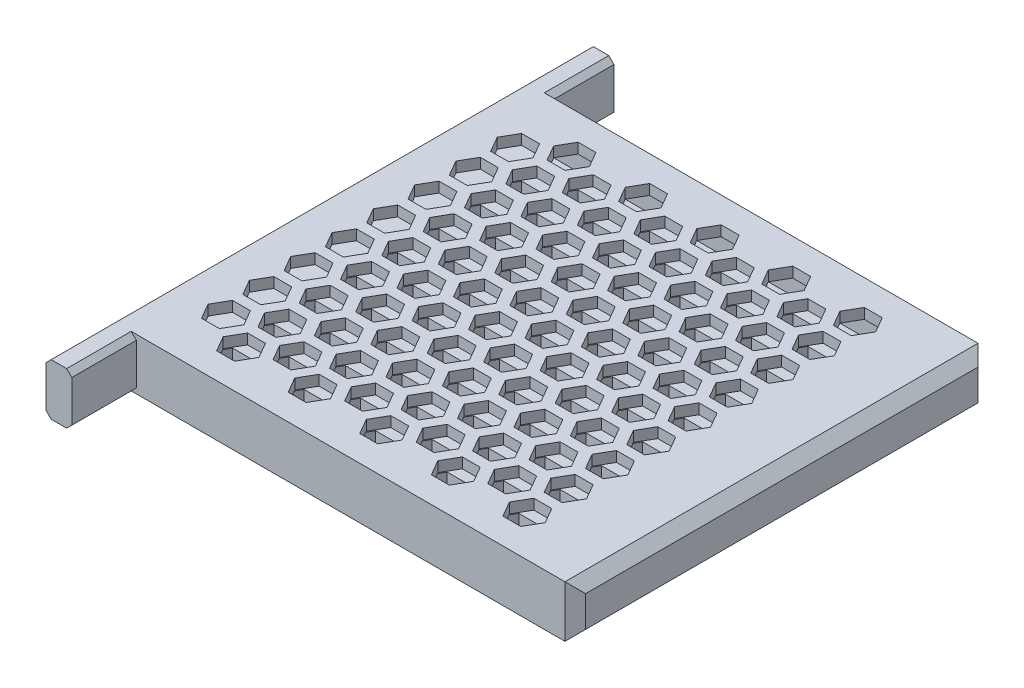
from build123d import *

# Parameters (mm, degrees)
ESQUISSE1_W                            = 90
ESQUISSE1_H                            = 80
BOSS_EXTRU_1_DEPTH                     = 10
CHANFREIN1_SIZE                        = 2
COQUE1_T                               = -2
ESQUISSE2_W                            = 5
ESQUISSE2_H                            = 12.5
BOSS_EXTRU_2_DEPTH                     = 10
CHANFREIN2_SIZE                        = 1
ENL_V_MAT_EXTRU_1_DEPTH                = 10
R_P_TITION_LIN_AIRE2_COUNT             = 2
R_P_TITION_LIN_AIRE2_PITCH             = 8
R_P_TITION_LIN_AIRE3_COUNT             = 4
R_P_TITION_LIN_AIRE3_PITCH             = 8
R_P_TITION_LIN_AIRE3_COPY_1_DEPTH      = 10
R_P_TITION_LIN_AIRE3_COPY_2_DEPTH      = 10
R_P_TITION_LIN_AIRE3_COPY_3_DEPTH      = 10
R_P_TITION_LIN_AIRE3_COL_COUNT         = 5
R_P_TITION_LIN_AIRE3_COL_PITCH         = 8
R_P_TITION_LIN_AIRE3_COL_COPY_1_DEPTH  = 10
R_P_TITION_LIN_AIRE3_COL_COPY_2_DEPTH  = 10
R_P_TITION_LIN_AIRE3_COL_COPY_3_DEPTH  = 10
R_P_TITION_LIN_AIRE3_COL_COPY_4_DEPTH  = 10
R_P_TITION_LIN_AIRE4_COUNT             = 2
R_P_TITION_LIN_AIRE4_PITCH             = 32
R_P_TITION_LIN_AIRE5_COUNT             = 3
R_P_TITION_LIN_AIRE5_PITCH             = 13.86
R_P_TITION_LIN_AIRE5_COPY_1_DEPTH      = 10
R_P_TITION_LIN_AIRE5_COPY_2_DEPTH      = 10
R_P_TITION_LIN_AIRE5_COPY_3_DEPTH      = 10
R_P_TITION_LIN_AIRE5_COPY_4_DEPTH      = 10
R_P_TITION_LIN_AIRE5_COPY_5_DEPTH      = 10
R_P_TITION_LIN_AIRE5_COPY_6_DEPTH      = 10
R_P_TITION_LIN_AIRE5_COPY_7_DEPTH      = 10
R_P_TITION_LIN_AIRE5_COPY_8_DEPTH      = 10
R_P_TITION_LIN_AIRE5_COPY_9_DEPTH      = 10
R_P_TITION_LIN_AIRE5_COPY_10_DEPTH     = 10
R_P_TITION_LIN_AIRE5_COPY_11_DEPTH     = 10
R_P_TITION_LIN_AIRE5_COPY_12_DEPTH     = 10
R_P_TITION_LIN_AIRE5_COPY_13_DEPTH     = 10
R_P_TITION_LIN_AIRE5_COPY_14_DEPTH     = 10
R_P_TITION_LIN_AIRE5_COPY_15_DEPTH     = 10
R_P_TITION_LIN_AIRE5_COPY_16_DEPTH     = 10
R_P_TITION_LIN_AIRE5_COPY_17_DEPTH     = 10
R_P_TITION_LIN_AIRE5_COPY_18_DEPTH     = 10
R_P_TITION_LIN_AIRE5_COPY_19_DEPTH     = 10
R_P_TITION_LIN_AIRE5_COPY_20_DEPTH     = 10
R_P_TITION_LIN_AIRE5_COPY_21_DEPTH     = 10
R_P_TITION_LIN_AIRE5_COPY_22_DEPTH     = 10
R_P_TITION_LIN_AIRE5_COPY_23_DEPTH     = 10
R_P_TITION_LIN_AIRE5_COPY_24_DEPTH     = 10
R_P_TITION_LIN_AIRE5_COPY_25_DEPTH     = 10
R_P_TITION_LIN_AIRE5_COPY_26_DEPTH     = 10
R_P_TITION_LIN_AIRE5_COPY_27_DEPTH     = 10
R_P_TITION_LIN_AIRE5_COPY_28_DEPTH     = 10
R_P_TITION_LIN_AIRE5_COPY_29_DEPTH     = 10
R_P_TITION_LIN_AIRE5_COPY_30_DEPTH     = 10
R_P_TITION_LIN_AIRE5_COPY_31_DEPTH     = 10
R_P_TITION_LIN_AIRE5_COPY_32_DEPTH     = 10
R_P_TITION_LIN_AIRE5_COL_COUNT         = 3
R_P_TITION_LIN_AIRE5_COL_PITCH         = 13.86
R_P_TITION_LIN_AIRE5_COL_COPY_1_DEPTH  = 10
R_P_TITION_LIN_AIRE5_COL_COPY_2_DEPTH  = 10
R_P_TITION_LIN_AIRE5_COL_COPY_3_DEPTH  = 10
R_P_TITION_LIN_AIRE5_COL_COPY_4_DEPTH  = 10
R_P_TITION_LIN_AIRE5_COL_COPY_5_DEPTH  = 10
R_P_TITION_LIN_AIRE5_COL_COPY_6_DEPTH  = 10
R_P_TITION_LIN_AIRE5_COL_COPY_7_DEPTH  = 10
R_P_TITION_LIN_AIRE5_COL_COPY_8_DEPTH  = 10
R_P_TITION_LIN_AIRE5_COL_COPY_9_DEPTH  = 10
R_P_TITION_LIN_AIRE5_COL_COPY_10_DEPTH = 10
R_P_TITION_LIN_AIRE5_COL_COPY_11_DEPTH = 10
R_P_TITION_LIN_AIRE5_COL_COPY_12_DEPTH = 10
R_P_TITION_LIN_AIRE5_COL_COPY_13_DEPTH = 10
R_P_TITION_LIN_AIRE5_COL_COPY_14_DEPTH = 10
R_P_TITION_LIN_AIRE5_COL_COPY_15_DEPTH = 10
R_P_TITION_LIN_AIRE5_COL_COPY_16_DEPTH = 10
R_P_TITION_LIN_AIRE5_COL_COPY_17_DEPTH = 10
R_P_TITION_LIN_AIRE5_COL_COPY_18_DEPTH = 10
R_P_TITION_LIN_AIRE5_COL_COPY_19_DEPTH = 10
R_P_TITION_LIN_AIRE5_COL_COPY_20_DEPTH = 10
R_P_TITION_LIN_AIRE5_COL_COPY_21_DEPTH = 10
R_P_TITION_LIN_AIRE5_COL_COPY_22_DEPTH = 10
R_P_TITION_LIN_AIRE5_COL_COPY_23_DEPTH = 10
R_P_TITION_LIN_AIRE5_COL_COPY_24_DEPTH = 10
R_P_TITION_LIN_AIRE5_COL_COPY_25_DEPTH = 10
R_P_TITION_LIN_AIRE5_COL_COPY_26_DEPTH = 10
R_P_TITION_LIN_AIRE5_COL_COPY_27_DEPTH = 10
R_P_TITION_LIN_AIRE5_COL_COPY_28_DEPTH = 10
R_P_TITION_LIN_AIRE5_COL_COPY_29_DEPTH = 10
R_P_TITION_LIN_AIRE5_COL_COPY_30_DEPTH = 10
R_P_TITION_LIN_AIRE5_COL_COPY_31_DEPTH = 10
R_P_TITION_LIN_AIRE5_COL_COPY_32_DEPTH = 10


with BuildPart() as part:
    # Esquisse1 → Boss.-Extru.1 (new body)
    with BuildSketch(Plane(origin=(0, 0, 0), x_dir=(1, 0, 0), z_dir=(0, 1, 0))):
        Rectangle(ESQUISSE1_W, ESQUISSE1_H)
    extrude(amount=BOSS_EXTRU_1_DEPTH)

    # Chanfrein1
    chanfrein1_edges = [part.edges().sort_by_distance(p)[0] for p in [
        (45, 0, 0),
        (45, 5, -40),
        (45, 5, 40),
        (45, 10, 0),
    ]]
    chamfer(chanfrein1_edges, length=CHANFREIN1_SIZE)

    # Coque1
    coque1_openings = [part.faces().sort_by_distance(p)[0] for p in [
        (-45, 5, 0),
    ]]
    offset(amount=COQUE1_T, openings=coque1_openings, kind=Kind.INTERSECTION)

    # Esquisse2 → Boss.-Extru.2 (add)
    with BuildSketch(Plane(origin=(0, 10, 0), x_dir=(1, 0, 0), z_dir=(0, 1, 0))):
        with Locations((-42.5, 46.25)):
            Rectangle(ESQUISSE2_W, ESQUISSE2_H)
        with Locations((-42.5, -46.25)):
            Rectangle(ESQUISSE2_W, ESQUISSE2_H)
    extrude(amount=-BOSS_EXTRU_2_DEPTH)

    # Chanfrein2
    chanfrein2_edges = [part.edges().sort_by_distance(p)[0] for p in [
        (-45, 10, 0),
        (-40, 0, 46.25),
        (-45, 0, 0),
        (-40, 10, 46.25),
        (-40, 0, -46.25),
        (-40, 10, -46.25),
    ]]
    chamfer(chanfrein2_edges, length=CHANFREIN2_SIZE)

    # Esquisse3 → Enlèv. mat.-Extru.1 (cut)
    with BuildSketch(Plane.XZ):
        Polygon((3.464101615, 0), (1.732050808, 3), (-1.732050808, 3), (-3.464101615, 0), (-1.732050808, -3), (1.732050808, -3), align=None)
    enl_v_mat_extru_1 = extrude(amount=-ENL_V_MAT_EXTRU_1_DEPTH, mode=Mode.SUBTRACT)

    # Répétition linéaire2: Enlèv. mat.-Extru.1 ×2
    with Locations(*[Vector(-0.8660254037844387, 0, 0.5000000000000001) * (i * R_P_TITION_LIN_AIRE2_PITCH) for i in range(1, R_P_TITION_LIN_AIRE2_COUNT)]):
        add(enl_v_mat_extru_1, mode=Mode.SUBTRACT)

    # Répétition linéaire3: Enlèv. mat.-Extru.1 ×4
    with Locations(*[(0, 0, i * R_P_TITION_LIN_AIRE3_PITCH) for i in range(1, R_P_TITION_LIN_AIRE3_COUNT)]):
        add(enl_v_mat_extru_1, mode=Mode.SUBTRACT)

    # Répétition linéaire3 copy 1 sketch → Répétition linéaire3 copy 1 (cut)
    with BuildSketch(Plane(origin=(-6.92820323, 0, 12), x_dir=(1, 0, 0), z_dir=(0, -1, 0))):
        Polygon((3.464101615, 0), (1.732050808, 3), (-1.732050808, 3), (-3.464101615, 0), (-1.732050808, -3), (1.732050808, -3), align=None)
    extrude(amount=-R_P_TITION_LIN_AIRE3_COPY_1_DEPTH, mode=Mode.SUBTRACT)

    # Répétition linéaire3 copy 2 sketch → Répétition linéaire3 copy 2 (cut)
    with BuildSketch(Plane(origin=(-6.92820323, 0, 20), x_dir=(1, 0, 0), z_dir=(0, -1, 0))):
        Polygon((3.464101615, 0), (1.732050808, 3), (-1.732050808, 3), (-3.464101615, 0), (-1.732050808, -3), (1.732050808, -3), align=None)
    extrude(amount=-R_P_TITION_LIN_AIRE3_COPY_2_DEPTH, mode=Mode.SUBTRACT)

    # Répétition linéaire3 copy 3 sketch → Répétition linéaire3 copy 3 (cut)
    with BuildSketch(Plane(origin=(-6.92820323, 0, 28), x_dir=(1, 0, 0), z_dir=(0, -1, 0))):
        Polygon((3.464101615, 0), (1.732050808, 3), (-1.732050808, 3), (-3.464101615, 0), (-1.732050808, -3), (1.732050808, -3), align=None)
    extrude(amount=-R_P_TITION_LIN_AIRE3_COPY_3_DEPTH, mode=Mode.SUBTRACT)

    # Répétition linéaire3 col: Enlèv. mat.-Extru.1 ×5
    with Locations(*[(0, 0, -i * R_P_TITION_LIN_AIRE3_COL_PITCH) for i in range(1, R_P_TITION_LIN_AIRE3_COL_COUNT)]):
        add(enl_v_mat_extru_1, mode=Mode.SUBTRACT)

    # Répétition linéaire3 col copy 1 sketch → Répétition linéaire3 col copy 1 (cut)
    with BuildSketch(Plane(origin=(-6.92820323, 0, -4), x_dir=(1, 0, 0), z_dir=(0, -1, 0))):
        Polygon((3.464101615, 0), (1.732050808, 3), (-1.732050808, 3), (-3.464101615, 0), (-1.732050808, -3), (1.732050808, -3), align=None)
    extrude(amount=-R_P_TITION_LIN_AIRE3_COL_COPY_1_DEPTH, mode=Mode.SUBTRACT)

    # Répétition linéaire3 col copy 2 sketch → Répétition linéaire3 col copy 2 (cut)
    with BuildSketch(Plane(origin=(-6.92820323, 0, -12), x_dir=(1, 0, 0), z_dir=(0, -1, 0))):
        Polygon((3.464101615, 0), (1.732050808, 3), (-1.732050808, 3), (-3.464101615, 0), (-1.732050808, -3), (1.732050808, -3), align=None)
    extrude(amount=-R_P_TITION_LIN_AIRE3_COL_COPY_2_DEPTH, mode=Mode.SUBTRACT)

    # Répétition linéaire3 col copy 3 sketch → Répétition linéaire3 col copy 3 (cut)
    with BuildSketch(Plane(origin=(-6.92820323, 0, -20), x_dir=(1, 0, 0), z_dir=(0, -1, 0))):
        Polygon((3.464101615, 0), (1.732050808, 3), (-1.732050808, 3), (-3.464101615, 0), (-1.732050808, -3), (1.732050808, -3), align=None)
    extrude(amount=-R_P_TITION_LIN_AIRE3_COL_COPY_3_DEPTH, mode=Mode.SUBTRACT)

    # Répétition linéaire3 col copy 4 sketch → Répétition linéaire3 col copy 4 (cut)
    with BuildSketch(Plane(origin=(-6.92820323, 0, -28), x_dir=(1, 0, 0), z_dir=(0, -1, 0))):
        Polygon((3.464101615, 0), (1.732050808, 3), (-1.732050808, 3), (-3.464101615, 0), (-1.732050808, -3), (1.732050808, -3), align=None)
    extrude(amount=-R_P_TITION_LIN_AIRE3_COL_COPY_4_DEPTH, mode=Mode.SUBTRACT)

    # Répétition linéaire4: Enlèv. mat.-Extru.1 ×2
    with Locations(*[(0, 0, i * R_P_TITION_LIN_AIRE4_PITCH) for i in range(1, R_P_TITION_LIN_AIRE4_COUNT)]):
        add(enl_v_mat_extru_1, mode=Mode.SUBTRACT)

    # Répétition linéaire5: Enlèv. mat.-Extru.1 ×3
    with Locations(*[(i * R_P_TITION_LIN_AIRE5_PITCH, 0, 0) for i in range(1, R_P_TITION_LIN_AIRE5_COUNT)]):
        add(enl_v_mat_extru_1, mode=Mode.SUBTRACT)

    # Répétition linéaire5 copy 1 sketch → Répétition linéaire5 copy 1 (cut)
    with BuildSketch(Plane(origin=(6.93179677, 0, 4), x_dir=(1, 0, 0), z_dir=(0, -1, 0))):
        Polygon((3.464101615, 0), (1.732050808, 3), (-1.732050808, 3), (-3.464101615, 0), (-1.732050808, -3), (1.732050808, -3), align=None)
    extrude(amount=-R_P_TITION_LIN_AIRE5_COPY_1_DEPTH, mode=Mode.SUBTRACT)

    # Répétition linéaire5 copy 2 sketch → Répétition linéaire5 copy 2 (cut)
    with BuildSketch(Plane(origin=(20.79179677, 0, 4), x_dir=(1, 0, 0), z_dir=(0, -1, 0))):
        Polygon((3.464101615, 0), (1.732050808, 3), (-1.732050808, 3), (-3.464101615, 0), (-1.732050808, -3), (1.732050808, -3), align=None)
    extrude(amount=-R_P_TITION_LIN_AIRE5_COPY_2_DEPTH, mode=Mode.SUBTRACT)

    # Répétition linéaire5 copy 3 sketch → Répétition linéaire5 copy 3 (cut)
    with BuildSketch(Plane(origin=(13.86, 0, 8), x_dir=(1, 0, 0), z_dir=(0, -1, 0))):
        Polygon((3.464101615, 0), (1.732050808, 3), (-1.732050808, 3), (-3.464101615, 0), (-1.732050808, -3), (1.732050808, -3), align=None)
    extrude(amount=-R_P_TITION_LIN_AIRE5_COPY_3_DEPTH, mode=Mode.SUBTRACT)

    # Répétition linéaire5 copy 4 sketch → Répétition linéaire5 copy 4 (cut)
    with BuildSketch(Plane(origin=(27.72, 0, 8), x_dir=(1, 0, 0), z_dir=(0, -1, 0))):
        Polygon((3.464101615, 0), (1.732050808, 3), (-1.732050808, 3), (-3.464101615, 0), (-1.732050808, -3), (1.732050808, -3), align=None)
    extrude(amount=-R_P_TITION_LIN_AIRE5_COPY_4_DEPTH, mode=Mode.SUBTRACT)

    # Répétition linéaire5 copy 5 sketch → Répétition linéaire5 copy 5 (cut)
    with BuildSketch(Plane(origin=(13.86, 0, 16), x_dir=(1, 0, 0), z_dir=(0, -1, 0))):
        Polygon((3.464101615, 0), (1.732050808, 3), (-1.732050808, 3), (-3.464101615, 0), (-1.732050808, -3), (1.732050808, -3), align=None)
    extrude(amount=-R_P_TITION_LIN_AIRE5_COPY_5_DEPTH, mode=Mode.SUBTRACT)

    # Répétition linéaire5 copy 6 sketch → Répétition linéaire5 copy 6 (cut)
    with BuildSketch(Plane(origin=(27.72, 0, 16), x_dir=(1, 0, 0), z_dir=(0, -1, 0))):
        Polygon((3.464101615, 0), (1.732050808, 3), (-1.732050808, 3), (-3.464101615, 0), (-1.732050808, -3), (1.732050808, -3), align=None)
    extrude(amount=-R_P_TITION_LIN_AIRE5_COPY_6_DEPTH, mode=Mode.SUBTRACT)

    # Répétition linéaire5 copy 7 sketch → Répétition linéaire5 copy 7 (cut)
    with BuildSketch(Plane(origin=(13.86, 0, 24), x_dir=(1, 0, 0), z_dir=(0, -1, 0))):
        Polygon((3.464101615, 0), (1.732050808, 3), (-1.732050808, 3), (-3.464101615, 0), (-1.732050808, -3), (1.732050808, -3), align=None)
    extrude(amount=-R_P_TITION_LIN_AIRE5_COPY_7_DEPTH, mode=Mode.SUBTRACT)

    # Répétition linéaire5 copy 8 sketch → Répétition linéaire5 copy 8 (cut)
    with BuildSketch(Plane(origin=(27.72, 0, 24), x_dir=(1, 0, 0), z_dir=(0, -1, 0))):
        Polygon((3.464101615, 0), (1.732050808, 3), (-1.732050808, 3), (-3.464101615, 0), (-1.732050808, -3), (1.732050808, -3), align=None)
    extrude(amount=-R_P_TITION_LIN_AIRE5_COPY_8_DEPTH, mode=Mode.SUBTRACT)

    # Répétition linéaire5 copy 9 sketch → Répétition linéaire5 copy 9 (cut)
    with BuildSketch(Plane(origin=(6.93179677, 0, 12), x_dir=(1, 0, 0), z_dir=(0, -1, 0))):
        Polygon((3.464101615, 0), (1.732050808, 3), (-1.732050808, 3), (-3.464101615, 0), (-1.732050808, -3), (1.732050808, -3), align=None)
    extrude(amount=-R_P_TITION_LIN_AIRE5_COPY_9_DEPTH, mode=Mode.SUBTRACT)

    # Répétition linéaire5 copy 10 sketch → Répétition linéaire5 copy 10 (cut)
    with BuildSketch(Plane(origin=(20.79179677, 0, 12), x_dir=(1, 0, 0), z_dir=(0, -1, 0))):
        Polygon((3.464101615, 0), (1.732050808, 3), (-1.732050808, 3), (-3.464101615, 0), (-1.732050808, -3), (1.732050808, -3), align=None)
    extrude(amount=-R_P_TITION_LIN_AIRE5_COPY_10_DEPTH, mode=Mode.SUBTRACT)

    # Répétition linéaire5 copy 11 sketch → Répétition linéaire5 copy 11 (cut)
    with BuildSketch(Plane(origin=(6.93179677, 0, 20), x_dir=(1, 0, 0), z_dir=(0, -1, 0))):
        Polygon((3.464101615, 0), (1.732050808, 3), (-1.732050808, 3), (-3.464101615, 0), (-1.732050808, -3), (1.732050808, -3), align=None)
    extrude(amount=-R_P_TITION_LIN_AIRE5_COPY_11_DEPTH, mode=Mode.SUBTRACT)

    # Répétition linéaire5 copy 12 sketch → Répétition linéaire5 copy 12 (cut)
    with BuildSketch(Plane(origin=(20.79179677, 0, 20), x_dir=(1, 0, 0), z_dir=(0, -1, 0))):
        Polygon((3.464101615, 0), (1.732050808, 3), (-1.732050808, 3), (-3.464101615, 0), (-1.732050808, -3), (1.732050808, -3), align=None)
    extrude(amount=-R_P_TITION_LIN_AIRE5_COPY_12_DEPTH, mode=Mode.SUBTRACT)

    # Répétition linéaire5 copy 13 sketch → Répétition linéaire5 copy 13 (cut)
    with BuildSketch(Plane(origin=(6.93179677, 0, 28), x_dir=(1, 0, 0), z_dir=(0, -1, 0))):
        Polygon((3.464101615, 0), (1.732050808, 3), (-1.732050808, 3), (-3.464101615, 0), (-1.732050808, -3), (1.732050808, -3), align=None)
    extrude(amount=-R_P_TITION_LIN_AIRE5_COPY_13_DEPTH, mode=Mode.SUBTRACT)

    # Répétition linéaire5 copy 14 sketch → Répétition linéaire5 copy 14 (cut)
    with BuildSketch(Plane(origin=(20.79179677, 0, 28), x_dir=(1, 0, 0), z_dir=(0, -1, 0))):
        Polygon((3.464101615, 0), (1.732050808, 3), (-1.732050808, 3), (-3.464101615, 0), (-1.732050808, -3), (1.732050808, -3), align=None)
    extrude(amount=-R_P_TITION_LIN_AIRE5_COPY_14_DEPTH, mode=Mode.SUBTRACT)

    # Répétition linéaire5 copy 15 sketch → Répétition linéaire5 copy 15 (cut)
    with BuildSketch(Plane(origin=(13.86, 0, -8), x_dir=(1, 0, 0), z_dir=(0, -1, 0))):
        Polygon((3.464101615, 0), (1.732050808, 3), (-1.732050808, 3), (-3.464101615, 0), (-1.732050808, -3), (1.732050808, -3), align=None)
    extrude(amount=-R_P_TITION_LIN_AIRE5_COPY_15_DEPTH, mode=Mode.SUBTRACT)

    # Répétition linéaire5 copy 16 sketch → Répétition linéaire5 copy 16 (cut)
    with BuildSketch(Plane(origin=(27.72, 0, -8), x_dir=(1, 0, 0), z_dir=(0, -1, 0))):
        Polygon((3.464101615, 0), (1.732050808, 3), (-1.732050808, 3), (-3.464101615, 0), (-1.732050808, -3), (1.732050808, -3), align=None)
    extrude(amount=-R_P_TITION_LIN_AIRE5_COPY_16_DEPTH, mode=Mode.SUBTRACT)

    # Répétition linéaire5 copy 17 sketch → Répétition linéaire5 copy 17 (cut)
    with BuildSketch(Plane(origin=(13.86, 0, -16), x_dir=(1, 0, 0), z_dir=(0, -1, 0))):
        Polygon((3.464101615, 0), (1.732050808, 3), (-1.732050808, 3), (-3.464101615, 0), (-1.732050808, -3), (1.732050808, -3), align=None)
    extrude(amount=-R_P_TITION_LIN_AIRE5_COPY_17_DEPTH, mode=Mode.SUBTRACT)

    # Répétition linéaire5 copy 18 sketch → Répétition linéaire5 copy 18 (cut)
    with BuildSketch(Plane(origin=(27.72, 0, -16), x_dir=(1, 0, 0), z_dir=(0, -1, 0))):
        Polygon((3.464101615, 0), (1.732050808, 3), (-1.732050808, 3), (-3.464101615, 0), (-1.732050808, -3), (1.732050808, -3), align=None)
    extrude(amount=-R_P_TITION_LIN_AIRE5_COPY_18_DEPTH, mode=Mode.SUBTRACT)

    # Répétition linéaire5 copy 19 sketch → Répétition linéaire5 copy 19 (cut)
    with BuildSketch(Plane(origin=(13.86, 0, -24), x_dir=(1, 0, 0), z_dir=(0, -1, 0))):
        Polygon((3.464101615, 0), (1.732050808, 3), (-1.732050808, 3), (-3.464101615, 0), (-1.732050808, -3), (1.732050808, -3), align=None)
    extrude(amount=-R_P_TITION_LIN_AIRE5_COPY_19_DEPTH, mode=Mode.SUBTRACT)

    # Répétition linéaire5 copy 20 sketch → Répétition linéaire5 copy 20 (cut)
    with BuildSketch(Plane(origin=(27.72, 0, -24), x_dir=(1, 0, 0), z_dir=(0, -1, 0))):
        Polygon((3.464101615, 0), (1.732050808, 3), (-1.732050808, 3), (-3.464101615, 0), (-1.732050808, -3), (1.732050808, -3), align=None)
    extrude(amount=-R_P_TITION_LIN_AIRE5_COPY_20_DEPTH, mode=Mode.SUBTRACT)

    # Répétition linéaire5 copy 21 sketch → Répétition linéaire5 copy 21 (cut)
    with BuildSketch(Plane(origin=(13.86, 0, -32), x_dir=(1, 0, 0), z_dir=(0, -1, 0))):
        Polygon((3.464101615, 0), (1.732050808, 3), (-1.732050808, 3), (-3.464101615, 0), (-1.732050808, -3), (1.732050808, -3), align=None)
    extrude(amount=-R_P_TITION_LIN_AIRE5_COPY_21_DEPTH, mode=Mode.SUBTRACT)

    # Répétition linéaire5 copy 22 sketch → Répétition linéaire5 copy 22 (cut)
    with BuildSketch(Plane(origin=(27.72, 0, -32), x_dir=(1, 0, 0), z_dir=(0, -1, 0))):
        Polygon((3.464101615, 0), (1.732050808, 3), (-1.732050808, 3), (-3.464101615, 0), (-1.732050808, -3), (1.732050808, -3), align=None)
    extrude(amount=-R_P_TITION_LIN_AIRE5_COPY_22_DEPTH, mode=Mode.SUBTRACT)

    # Répétition linéaire5 copy 23 sketch → Répétition linéaire5 copy 23 (cut)
    with BuildSketch(Plane(origin=(6.93179677, 0, -4), x_dir=(1, 0, 0), z_dir=(0, -1, 0))):
        Polygon((3.464101615, 0), (1.732050808, 3), (-1.732050808, 3), (-3.464101615, 0), (-1.732050808, -3), (1.732050808, -3), align=None)
    extrude(amount=-R_P_TITION_LIN_AIRE5_COPY_23_DEPTH, mode=Mode.SUBTRACT)

    # Répétition linéaire5 copy 24 sketch → Répétition linéaire5 copy 24 (cut)
    with BuildSketch(Plane(origin=(20.79179677, 0, -4), x_dir=(1, 0, 0), z_dir=(0, -1, 0))):
        Polygon((3.464101615, 0), (1.732050808, 3), (-1.732050808, 3), (-3.464101615, 0), (-1.732050808, -3), (1.732050808, -3), align=None)
    extrude(amount=-R_P_TITION_LIN_AIRE5_COPY_24_DEPTH, mode=Mode.SUBTRACT)

    # Répétition linéaire5 copy 25 sketch → Répétition linéaire5 copy 25 (cut)
    with BuildSketch(Plane(origin=(6.93179677, 0, -12), x_dir=(1, 0, 0), z_dir=(0, -1, 0))):
        Polygon((3.464101615, 0), (1.732050808, 3), (-1.732050808, 3), (-3.464101615, 0), (-1.732050808, -3), (1.732050808, -3), align=None)
    extrude(amount=-R_P_TITION_LIN_AIRE5_COPY_25_DEPTH, mode=Mode.SUBTRACT)

    # Répétition linéaire5 copy 26 sketch → Répétition linéaire5 copy 26 (cut)
    with BuildSketch(Plane(origin=(20.79179677, 0, -12), x_dir=(1, 0, 0), z_dir=(0, -1, 0))):
        Polygon((3.464101615, 0), (1.732050808, 3), (-1.732050808, 3), (-3.464101615, 0), (-1.732050808, -3), (1.732050808, -3), align=None)
    extrude(amount=-R_P_TITION_LIN_AIRE5_COPY_26_DEPTH, mode=Mode.SUBTRACT)

    # Répétition linéaire5 copy 27 sketch → Répétition linéaire5 copy 27 (cut)
    with BuildSketch(Plane(origin=(6.93179677, 0, -20), x_dir=(1, 0, 0), z_dir=(0, -1, 0))):
        Polygon((3.464101615, 0), (1.732050808, 3), (-1.732050808, 3), (-3.464101615, 0), (-1.732050808, -3), (1.732050808, -3), align=None)
    extrude(amount=-R_P_TITION_LIN_AIRE5_COPY_27_DEPTH, mode=Mode.SUBTRACT)

    # Répétition linéaire5 copy 28 sketch → Répétition linéaire5 copy 28 (cut)
    with BuildSketch(Plane(origin=(20.79179677, 0, -20), x_dir=(1, 0, 0), z_dir=(0, -1, 0))):
        Polygon((3.464101615, 0), (1.732050808, 3), (-1.732050808, 3), (-3.464101615, 0), (-1.732050808, -3), (1.732050808, -3), align=None)
    extrude(amount=-R_P_TITION_LIN_AIRE5_COPY_28_DEPTH, mode=Mode.SUBTRACT)

    # Répétition linéaire5 copy 29 sketch → Répétition linéaire5 copy 29 (cut)
    with BuildSketch(Plane(origin=(6.93179677, 0, -28), x_dir=(1, 0, 0), z_dir=(0, -1, 0))):
        Polygon((3.464101615, 0), (1.732050808, 3), (-1.732050808, 3), (-3.464101615, 0), (-1.732050808, -3), (1.732050808, -3), align=None)
    extrude(amount=-R_P_TITION_LIN_AIRE5_COPY_29_DEPTH, mode=Mode.SUBTRACT)

    # Répétition linéaire5 copy 30 sketch → Répétition linéaire5 copy 30 (cut)
    with BuildSketch(Plane(origin=(20.79179677, 0, -28), x_dir=(1, 0, 0), z_dir=(0, -1, 0))):
        Polygon((3.464101615, 0), (1.732050808, 3), (-1.732050808, 3), (-3.464101615, 0), (-1.732050808, -3), (1.732050808, -3), align=None)
    extrude(amount=-R_P_TITION_LIN_AIRE5_COPY_30_DEPTH, mode=Mode.SUBTRACT)

    # Répétition linéaire5 copy 31 sketch → Répétition linéaire5 copy 31 (cut)
    with BuildSketch(Plane(origin=(13.86, 0, 32), x_dir=(1, 0, 0), z_dir=(0, -1, 0))):
        Polygon((3.464101615, 0), (1.732050808, 3), (-1.732050808, 3), (-3.464101615, 0), (-1.732050808, -3), (1.732050808, -3), align=None)
    extrude(amount=-R_P_TITION_LIN_AIRE5_COPY_31_DEPTH, mode=Mode.SUBTRACT)

    # Répétition linéaire5 copy 32 sketch → Répétition linéaire5 copy 32 (cut)
    with BuildSketch(Plane(origin=(27.72, 0, 32), x_dir=(1, 0, 0), z_dir=(0, -1, 0))):
        Polygon((3.464101615, 0), (1.732050808, 3), (-1.732050808, 3), (-3.464101615, 0), (-1.732050808, -3), (1.732050808, -3), align=None)
    extrude(amount=-R_P_TITION_LIN_AIRE5_COPY_32_DEPTH, mode=Mode.SUBTRACT)

    # Répétition linéaire5 col: Enlèv. mat.-Extru.1 ×3
    with Locations(*[(-i * R_P_TITION_LIN_AIRE5_COL_PITCH, 0, 0) for i in range(1, R_P_TITION_LIN_AIRE5_COL_COUNT)]):
        add(enl_v_mat_extru_1, mode=Mode.SUBTRACT)

    # Répétition linéaire5 col copy 1 sketch → Répétition linéaire5 col copy 1 (cut)
    with BuildSketch(Plane(origin=(-20.78820323, 0, 4), x_dir=(1, 0, 0), z_dir=(0, -1, 0))):
        Polygon((3.464101615, 0), (1.732050808, 3), (-1.732050808, 3), (-3.464101615, 0), (-1.732050808, -3), (1.732050808, -3), align=None)
    extrude(amount=-R_P_TITION_LIN_AIRE5_COL_COPY_1_DEPTH, mode=Mode.SUBTRACT)

    # Répétition linéaire5 col copy 2 sketch → Répétition linéaire5 col copy 2 (cut)
    with BuildSketch(Plane(origin=(-34.64820323, 0, 4), x_dir=(1, 0, 0), z_dir=(0, -1, 0))):
        Polygon((3.464101615, 0), (1.732050808, 3), (-1.732050808, 3), (-3.464101615, 0), (-1.732050808, -3), (1.732050808, -3), align=None)
    extrude(amount=-R_P_TITION_LIN_AIRE5_COL_COPY_2_DEPTH, mode=Mode.SUBTRACT)

    # Répétition linéaire5 col copy 3 sketch → Répétition linéaire5 col copy 3 (cut)
    with BuildSketch(Plane(origin=(-13.86, 0, 8), x_dir=(1, 0, 0), z_dir=(0, -1, 0))):
        Polygon((3.464101615, 0), (1.732050808, 3), (-1.732050808, 3), (-3.464101615, 0), (-1.732050808, -3), (1.732050808, -3), align=None)
    extrude(amount=-R_P_TITION_LIN_AIRE5_COL_COPY_3_DEPTH, mode=Mode.SUBTRACT)

    # Répétition linéaire5 col copy 4 sketch → Répétition linéaire5 col copy 4 (cut)
    with BuildSketch(Plane(origin=(-27.72, 0, 8), x_dir=(1, 0, 0), z_dir=(0, -1, 0))):
        Polygon((3.464101615, 0), (1.732050808, 3), (-1.732050808, 3), (-3.464101615, 0), (-1.732050808, -3), (1.732050808, -3), align=None)
    extrude(amount=-R_P_TITION_LIN_AIRE5_COL_COPY_4_DEPTH, mode=Mode.SUBTRACT)

    # Répétition linéaire5 col copy 5 sketch → Répétition linéaire5 col copy 5 (cut)
    with BuildSketch(Plane(origin=(-13.86, 0, 16), x_dir=(1, 0, 0), z_dir=(0, -1, 0))):
        Polygon((3.464101615, 0), (1.732050808, 3), (-1.732050808, 3), (-3.464101615, 0), (-1.732050808, -3), (1.732050808, -3), align=None)
    extrude(amount=-R_P_TITION_LIN_AIRE5_COL_COPY_5_DEPTH, mode=Mode.SUBTRACT)

    # Répétition linéaire5 col copy 6 sketch → Répétition linéaire5 col copy 6 (cut)
    with BuildSketch(Plane(origin=(-27.72, 0, 16), x_dir=(1, 0, 0), z_dir=(0, -1, 0))):
        Polygon((3.464101615, 0), (1.732050808, 3), (-1.732050808, 3), (-3.464101615, 0), (-1.732050808, -3), (1.732050808, -3), align=None)
    extrude(amount=-R_P_TITION_LIN_AIRE5_COL_COPY_6_DEPTH, mode=Mode.SUBTRACT)

    # Répétition linéaire5 col copy 7 sketch → Répétition linéaire5 col copy 7 (cut)
    with BuildSketch(Plane(origin=(-13.86, 0, 24), x_dir=(1, 0, 0), z_dir=(0, -1, 0))):
        Polygon((3.464101615, 0), (1.732050808, 3), (-1.732050808, 3), (-3.464101615, 0), (-1.732050808, -3), (1.732050808, -3), align=None)
    extrude(amount=-R_P_TITION_LIN_AIRE5_COL_COPY_7_DEPTH, mode=Mode.SUBTRACT)

    # Répétition linéaire5 col copy 8 sketch → Répétition linéaire5 col copy 8 (cut)
    with BuildSketch(Plane(origin=(-27.72, 0, 24), x_dir=(1, 0, 0), z_dir=(0, -1, 0))):
        Polygon((3.464101615, 0), (1.732050808, 3), (-1.732050808, 3), (-3.464101615, 0), (-1.732050808, -3), (1.732050808, -3), align=None)
    extrude(amount=-R_P_TITION_LIN_AIRE5_COL_COPY_8_DEPTH, mode=Mode.SUBTRACT)

    # Répétition linéaire5 col copy 9 sketch → Répétition linéaire5 col copy 9 (cut)
    with BuildSketch(Plane(origin=(-20.78820323, 0, 12), x_dir=(1, 0, 0), z_dir=(0, -1, 0))):
        Polygon((3.464101615, 0), (1.732050808, 3), (-1.732050808, 3), (-3.464101615, 0), (-1.732050808, -3), (1.732050808, -3), align=None)
    extrude(amount=-R_P_TITION_LIN_AIRE5_COL_COPY_9_DEPTH, mode=Mode.SUBTRACT)

    # Répétition linéaire5 col copy 10 sketch → Répétition linéaire5 col copy 10 (cut)
    with BuildSketch(Plane(origin=(-34.64820323, 0, 12), x_dir=(1, 0, 0), z_dir=(0, -1, 0))):
        Polygon((3.464101615, 0), (1.732050808, 3), (-1.732050808, 3), (-3.464101615, 0), (-1.732050808, -3), (1.732050808, -3), align=None)
    extrude(amount=-R_P_TITION_LIN_AIRE5_COL_COPY_10_DEPTH, mode=Mode.SUBTRACT)

    # Répétition linéaire5 col copy 11 sketch → Répétition linéaire5 col copy 11 (cut)
    with BuildSketch(Plane(origin=(-20.78820323, 0, 20), x_dir=(1, 0, 0), z_dir=(0, -1, 0))):
        Polygon((3.464101615, 0), (1.732050808, 3), (-1.732050808, 3), (-3.464101615, 0), (-1.732050808, -3), (1.732050808, -3), align=None)
    extrude(amount=-R_P_TITION_LIN_AIRE5_COL_COPY_11_DEPTH, mode=Mode.SUBTRACT)

    # Répétition linéaire5 col copy 12 sketch → Répétition linéaire5 col copy 12 (cut)
    with BuildSketch(Plane(origin=(-34.64820323, 0, 20), x_dir=(1, 0, 0), z_dir=(0, -1, 0))):
        Polygon((3.464101615, 0), (1.732050808, 3), (-1.732050808, 3), (-3.464101615, 0), (-1.732050808, -3), (1.732050808, -3), align=None)
    extrude(amount=-R_P_TITION_LIN_AIRE5_COL_COPY_12_DEPTH, mode=Mode.SUBTRACT)

    # Répétition linéaire5 col copy 13 sketch → Répétition linéaire5 col copy 13 (cut)
    with BuildSketch(Plane(origin=(-20.78820323, 0, 28), x_dir=(1, 0, 0), z_dir=(0, -1, 0))):
        Polygon((3.464101615, 0), (1.732050808, 3), (-1.732050808, 3), (-3.464101615, 0), (-1.732050808, -3), (1.732050808, -3), align=None)
    extrude(amount=-R_P_TITION_LIN_AIRE5_COL_COPY_13_DEPTH, mode=Mode.SUBTRACT)

    # Répétition linéaire5 col copy 14 sketch → Répétition linéaire5 col copy 14 (cut)
    with BuildSketch(Plane(origin=(-34.64820323, 0, 28), x_dir=(1, 0, 0), z_dir=(0, -1, 0))):
        Polygon((3.464101615, 0), (1.732050808, 3), (-1.732050808, 3), (-3.464101615, 0), (-1.732050808, -3), (1.732050808, -3), align=None)
    extrude(amount=-R_P_TITION_LIN_AIRE5_COL_COPY_14_DEPTH, mode=Mode.SUBTRACT)

    # Répétition linéaire5 col copy 15 sketch → Répétition linéaire5 col copy 15 (cut)
    with BuildSketch(Plane(origin=(-13.86, 0, -8), x_dir=(1, 0, 0), z_dir=(0, -1, 0))):
        Polygon((3.464101615, 0), (1.732050808, 3), (-1.732050808, 3), (-3.464101615, 0), (-1.732050808, -3), (1.732050808, -3), align=None)
    extrude(amount=-R_P_TITION_LIN_AIRE5_COL_COPY_15_DEPTH, mode=Mode.SUBTRACT)

    # Répétition linéaire5 col copy 16 sketch → Répétition linéaire5 col copy 16 (cut)
    with BuildSketch(Plane(origin=(-27.72, 0, -8), x_dir=(1, 0, 0), z_dir=(0, -1, 0))):
        Polygon((3.464101615, 0), (1.732050808, 3), (-1.732050808, 3), (-3.464101615, 0), (-1.732050808, -3), (1.732050808, -3), align=None)
    extrude(amount=-R_P_TITION_LIN_AIRE5_COL_COPY_16_DEPTH, mode=Mode.SUBTRACT)

    # Répétition linéaire5 col copy 17 sketch → Répétition linéaire5 col copy 17 (cut)
    with BuildSketch(Plane(origin=(-13.86, 0, -16), x_dir=(1, 0, 0), z_dir=(0, -1, 0))):
        Polygon((3.464101615, 0), (1.732050808, 3), (-1.732050808, 3), (-3.464101615, 0), (-1.732050808, -3), (1.732050808, -3), align=None)
    extrude(amount=-R_P_TITION_LIN_AIRE5_COL_COPY_17_DEPTH, mode=Mode.SUBTRACT)

    # Répétition linéaire5 col copy 18 sketch → Répétition linéaire5 col copy 18 (cut)
    with BuildSketch(Plane(origin=(-27.72, 0, -16), x_dir=(1, 0, 0), z_dir=(0, -1, 0))):
        Polygon((3.464101615, 0), (1.732050808, 3), (-1.732050808, 3), (-3.464101615, 0), (-1.732050808, -3), (1.732050808, -3), align=None)
    extrude(amount=-R_P_TITION_LIN_AIRE5_COL_COPY_18_DEPTH, mode=Mode.SUBTRACT)

    # Répétition linéaire5 col copy 19 sketch → Répétition linéaire5 col copy 19 (cut)
    with BuildSketch(Plane(origin=(-13.86, 0, -24), x_dir=(1, 0, 0), z_dir=(0, -1, 0))):
        Polygon((3.464101615, 0), (1.732050808, 3), (-1.732050808, 3), (-3.464101615, 0), (-1.732050808, -3), (1.732050808, -3), align=None)
    extrude(amount=-R_P_TITION_LIN_AIRE5_COL_COPY_19_DEPTH, mode=Mode.SUBTRACT)

    # Répétition linéaire5 col copy 20 sketch → Répétition linéaire5 col copy 20 (cut)
    with BuildSketch(Plane(origin=(-27.72, 0, -24), x_dir=(1, 0, 0), z_dir=(0, -1, 0))):
        Polygon((3.464101615, 0), (1.732050808, 3), (-1.732050808, 3), (-3.464101615, 0), (-1.732050808, -3), (1.732050808, -3), align=None)
    extrude(amount=-R_P_TITION_LIN_AIRE5_COL_COPY_20_DEPTH, mode=Mode.SUBTRACT)

    # Répétition linéaire5 col copy 21 sketch → Répétition linéaire5 col copy 21 (cut)
    with BuildSketch(Plane(origin=(-13.86, 0, -32), x_dir=(1, 0, 0), z_dir=(0, -1, 0))):
        Polygon((3.464101615, 0), (1.732050808, 3), (-1.732050808, 3), (-3.464101615, 0), (-1.732050808, -3), (1.732050808, -3), align=None)
    extrude(amount=-R_P_TITION_LIN_AIRE5_COL_COPY_21_DEPTH, mode=Mode.SUBTRACT)

    # Répétition linéaire5 col copy 22 sketch → Répétition linéaire5 col copy 22 (cut)
    with BuildSketch(Plane(origin=(-27.72, 0, -32), x_dir=(1, 0, 0), z_dir=(0, -1, 0))):
        Polygon((3.464101615, 0), (1.732050808, 3), (-1.732050808, 3), (-3.464101615, 0), (-1.732050808, -3), (1.732050808, -3), align=None)
    extrude(amount=-R_P_TITION_LIN_AIRE5_COL_COPY_22_DEPTH, mode=Mode.SUBTRACT)

    # Répétition linéaire5 col copy 23 sketch → Répétition linéaire5 col copy 23 (cut)
    with BuildSketch(Plane(origin=(-20.78820323, 0, -4), x_dir=(1, 0, 0), z_dir=(0, -1, 0))):
        Polygon((3.464101615, 0), (1.732050808, 3), (-1.732050808, 3), (-3.464101615, 0), (-1.732050808, -3), (1.732050808, -3), align=None)
    extrude(amount=-R_P_TITION_LIN_AIRE5_COL_COPY_23_DEPTH, mode=Mode.SUBTRACT)

    # Répétition linéaire5 col copy 24 sketch → Répétition linéaire5 col copy 24 (cut)
    with BuildSketch(Plane(origin=(-34.64820323, 0, -4), x_dir=(1, 0, 0), z_dir=(0, -1, 0))):
        Polygon((3.464101615, 0), (1.732050808, 3), (-1.732050808, 3), (-3.464101615, 0), (-1.732050808, -3), (1.732050808, -3), align=None)
    extrude(amount=-R_P_TITION_LIN_AIRE5_COL_COPY_24_DEPTH, mode=Mode.SUBTRACT)

    # Répétition linéaire5 col copy 25 sketch → Répétition linéaire5 col copy 25 (cut)
    with BuildSketch(Plane(origin=(-20.78820323, 0, -12), x_dir=(1, 0, 0), z_dir=(0, -1, 0))):
        Polygon((3.464101615, 0), (1.732050808, 3), (-1.732050808, 3), (-3.464101615, 0), (-1.732050808, -3), (1.732050808, -3), align=None)
    extrude(amount=-R_P_TITION_LIN_AIRE5_COL_COPY_25_DEPTH, mode=Mode.SUBTRACT)

    # Répétition linéaire5 col copy 26 sketch → Répétition linéaire5 col copy 26 (cut)
    with BuildSketch(Plane(origin=(-34.64820323, 0, -12), x_dir=(1, 0, 0), z_dir=(0, -1, 0))):
        Polygon((3.464101615, 0), (1.732050808, 3), (-1.732050808, 3), (-3.464101615, 0), (-1.732050808, -3), (1.732050808, -3), align=None)
    extrude(amount=-R_P_TITION_LIN_AIRE5_COL_COPY_26_DEPTH, mode=Mode.SUBTRACT)

    # Répétition linéaire5 col copy 27 sketch → Répétition linéaire5 col copy 27 (cut)
    with BuildSketch(Plane(origin=(-20.78820323, 0, -20), x_dir=(1, 0, 0), z_dir=(0, -1, 0))):
        Polygon((3.464101615, 0), (1.732050808, 3), (-1.732050808, 3), (-3.464101615, 0), (-1.732050808, -3), (1.732050808, -3), align=None)
    extrude(amount=-R_P_TITION_LIN_AIRE5_COL_COPY_27_DEPTH, mode=Mode.SUBTRACT)

    # Répétition linéaire5 col copy 28 sketch → Répétition linéaire5 col copy 28 (cut)
    with BuildSketch(Plane(origin=(-34.64820323, 0, -20), x_dir=(1, 0, 0), z_dir=(0, -1, 0))):
        Polygon((3.464101615, 0), (1.732050808, 3), (-1.732050808, 3), (-3.464101615, 0), (-1.732050808, -3), (1.732050808, -3), align=None)
    extrude(amount=-R_P_TITION_LIN_AIRE5_COL_COPY_28_DEPTH, mode=Mode.SUBTRACT)

    # Répétition linéaire5 col copy 29 sketch → Répétition linéaire5 col copy 29 (cut)
    with BuildSketch(Plane(origin=(-20.78820323, 0, -28), x_dir=(1, 0, 0), z_dir=(0, -1, 0))):
        Polygon((3.464101615, 0), (1.732050808, 3), (-1.732050808, 3), (-3.464101615, 0), (-1.732050808, -3), (1.732050808, -3), align=None)
    extrude(amount=-R_P_TITION_LIN_AIRE5_COL_COPY_29_DEPTH, mode=Mode.SUBTRACT)

    # Répétition linéaire5 col copy 30 sketch → Répétition linéaire5 col copy 30 (cut)
    with BuildSketch(Plane(origin=(-34.64820323, 0, -28), x_dir=(1, 0, 0), z_dir=(0, -1, 0))):
        Polygon((3.464101615, 0), (1.732050808, 3), (-1.732050808, 3), (-3.464101615, 0), (-1.732050808, -3), (1.732050808, -3), align=None)
    extrude(amount=-R_P_TITION_LIN_AIRE5_COL_COPY_30_DEPTH, mode=Mode.SUBTRACT)

    # Répétition linéaire5 col copy 31 sketch → Répétition linéaire5 col copy 31 (cut)
    with BuildSketch(Plane(origin=(-13.86, 0, 32), x_dir=(1, 0, 0), z_dir=(0, -1, 0))):
        Polygon((3.464101615, 0), (1.732050808, 3), (-1.732050808, 3), (-3.464101615, 0), (-1.732050808, -3), (1.732050808, -3), align=None)
    extrude(amount=-R_P_TITION_LIN_AIRE5_COL_COPY_31_DEPTH, mode=Mode.SUBTRACT)

    # Répétition linéaire5 col copy 32 sketch → Répétition linéaire5 col copy 32 (cut)
    with BuildSketch(Plane(origin=(-27.72, 0, 32), x_dir=(1, 0, 0), z_dir=(0, -1, 0))):
        Polygon((3.464101615, 0), (1.732050808, 3), (-1.732050808, 3), (-3.464101615, 0), (-1.732050808, -3), (1.732050808, -3), align=None)
    extrude(amount=-R_P_TITION_LIN_AIRE5_COL_COPY_32_DEPTH, mode=Mode.SUBTRACT)


solid = part.part
